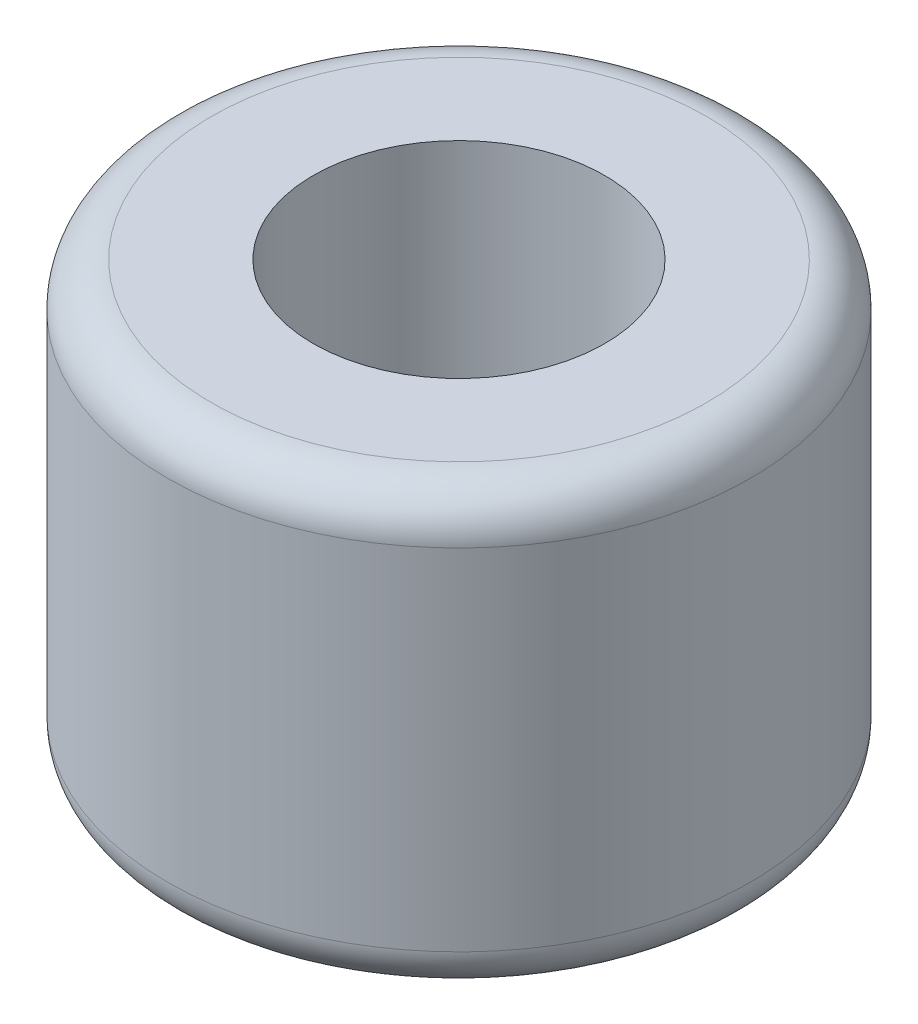
from build123d import *

# Parameters (mm, degrees)
CUT_EXTRUDE1_START = 12.7
SKETCH2_R          = 12.7
CUT_EXTRUDE1_DEPTH = 76.2
FILLET2_R          = 15.24


with BuildPart() as part:
    # Sketch1 → Revolve1 (revolve)
    with BuildSketch(Plane.XY, mode=Mode.PRIVATE) as revolve1_sk:
        Polygon((0, 0), (0, 25.4), (50.8, 25.4), (50.8, 152.4), (101.6, 152.4), (101.6, 0), align=None)
    revolve(revolve1_sk.sketch.rotate(Axis((0, 0, 0), (0, 1, 0)), 270), axis=Axis((0, 0, 0), (0, 1, 0)))

    # Sketch2 → Cut-Extrude1 (cut)
    with BuildSketch(Plane.XZ.offset(CUT_EXTRUDE1_START)):
        with Locations(Location((-76.2, 0, 0), (0, 0, 270))):
            Circle(SKETCH2_R)
        with Locations(Location((76.2, 0, 0), (0, 0, 270))):
            Circle(SKETCH2_R)
    extrude(amount=-CUT_EXTRUDE1_DEPTH, mode=Mode.SUBTRACT)

    # Fillet2
    # the kernel refuses this fillet: 15.24 mm, written as the material it takes off along each edge
    with BuildSketch(Plane(origin=(0, 0, 0), x_dir=(0, 0, 1), z_dir=(-1, 0, 0))) as fillet2_piece_1:
        with BuildLine():
            CenterArc((101.6 - FILLET2_R, FILLET2_R), FILLET2_R, 270, 90)
            Line((101.6 - FILLET2_R, 0), (101.6, 0))
            Line((101.6, 0), (101.6, FILLET2_R))
        make_face()
    revolve(axis=Axis((0, 0, 0), (0, 1, 0)), mode=Mode.SUBTRACT)
    with BuildSketch(Plane(origin=(0, 152.4, 0), x_dir=(0, 0, 1), z_dir=(-1, 0, 0))) as fillet2_piece_2:
        with BuildLine():
            CenterArc((101.6 - FILLET2_R, -FILLET2_R), FILLET2_R, 0, 90)
            Line((101.6, -FILLET2_R), (101.6, 0))
            Line((101.6, 0), (101.6 - FILLET2_R, 0))
        make_face()
    revolve(axis=Axis((0, 152.4, 0), (0, 1, 0)), mode=Mode.SUBTRACT)


solid = part.part
